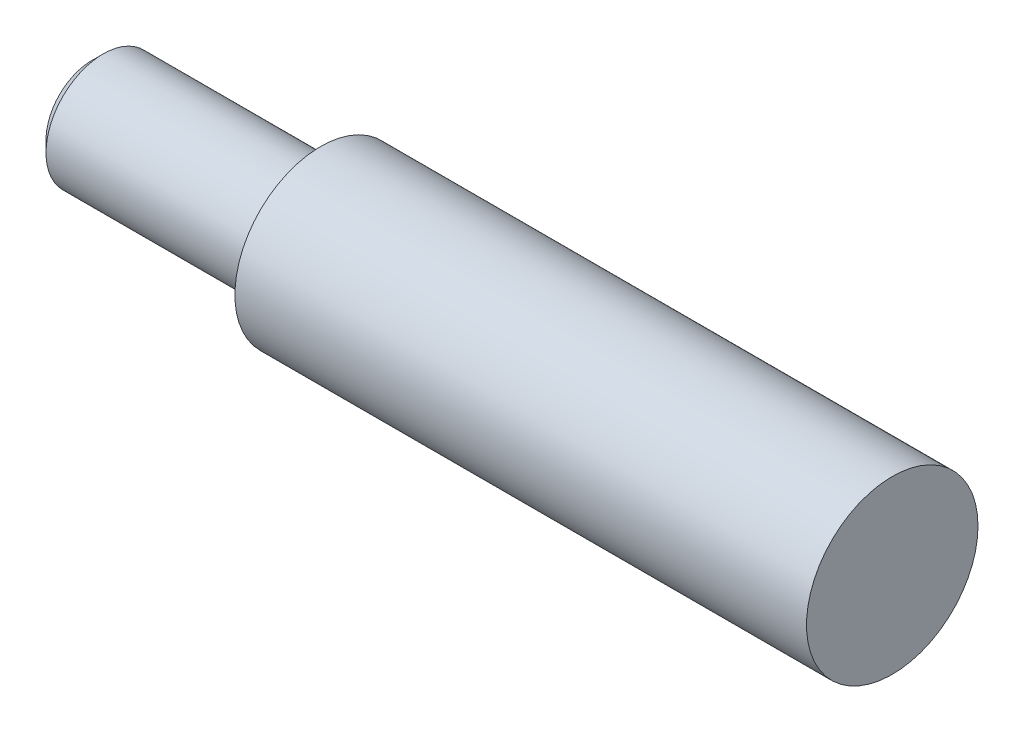
from build123d import *


# Read off the part's stored shape, not the designer's step: M4 Machine Threads Stud1
with BuildPart() as part:
    # Sketch1 → Revolve1 (revolve)
    with BuildSketch(Plane.XY, mode=Mode.PRIVATE) as revolve1_sk:
        Polygon((0, 0), (0, 2.5), (8, 2.5), (8, 3), (28, 3), (28, 0), align=None)
    revolve(revolve1_sk.sketch.rotate(Axis((28, 0, 0), (-1, 0, 0)), 90), axis=Axis((28, 0, 0), (-1, 0, 0)))

    # M4 Machine Threads Stud1 outline → M4 Machine Threads Stud1 (revolve, cut)
    with BuildSketch(Plane.YX):
        Polygon((2.5, 8), (2, 8), (2, 0.39), (1.61, 0), (2.5, 0), align=None)
    revolve(axis=Axis((0, 0, 0), (1, 0, 0)), mode=Mode.SUBTRACT)


solid = part.part
